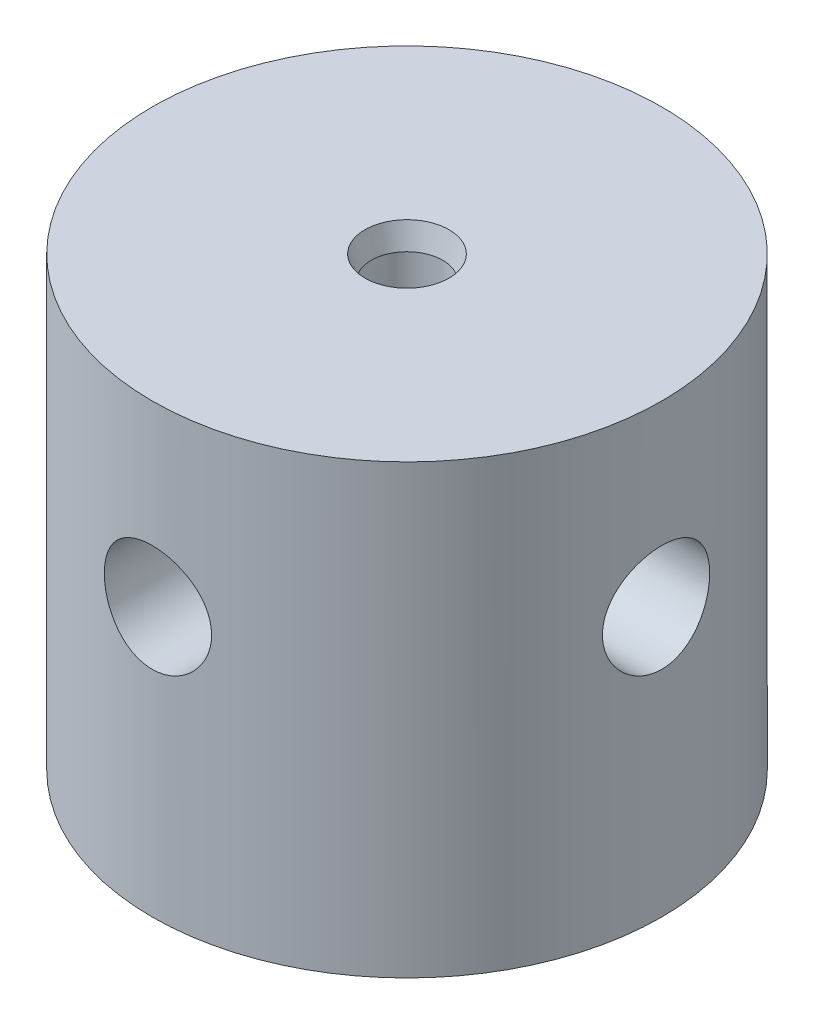
from build123d import *

# Parameters (mm, degrees)
SKETCH2_R          = 3
CUT_EXTRUDE1_DEPTH = 9
CIRPATTERN1_COUNT  = 4


with BuildPart() as part:
    # Sketch1 → Revolve1 (revolve)
    with BuildSketch(Plane.XY):
        Polygon((-2, 10.205702305), (-2, -10.205702305), (-14.25, -13.488079912), (-14.25, 11.511920088), (-2.35, 11.511920088), align=None)
    revolve(axis=Axis((0, 20.798274686, 0), (0, -1, 0)))

    # Sketch2 → Cut-Extrude1 (cut)
    with BuildSketch(Plane(origin=(14.25, 0, 0), x_dir=(0, 0, -1), z_dir=(1, 0, 0))):
        with Locations((0, 1.511920088)):
            Circle(SKETCH2_R)
    cut_extrude1 = extrude(amount=-CUT_EXTRUDE1_DEPTH, mode=Mode.SUBTRACT)

    # CirPattern1: Cut-Extrude1 ×4 about axis
    cirpattern1_axis = Axis((0, -13.488079912, 0), (0, 1, 0))
    for i in range(1, CIRPATTERN1_COUNT):
        add(cut_extrude1.rotate(cirpattern1_axis, i * 360 / CIRPATTERN1_COUNT), mode=Mode.SUBTRACT)


solid = part.part
